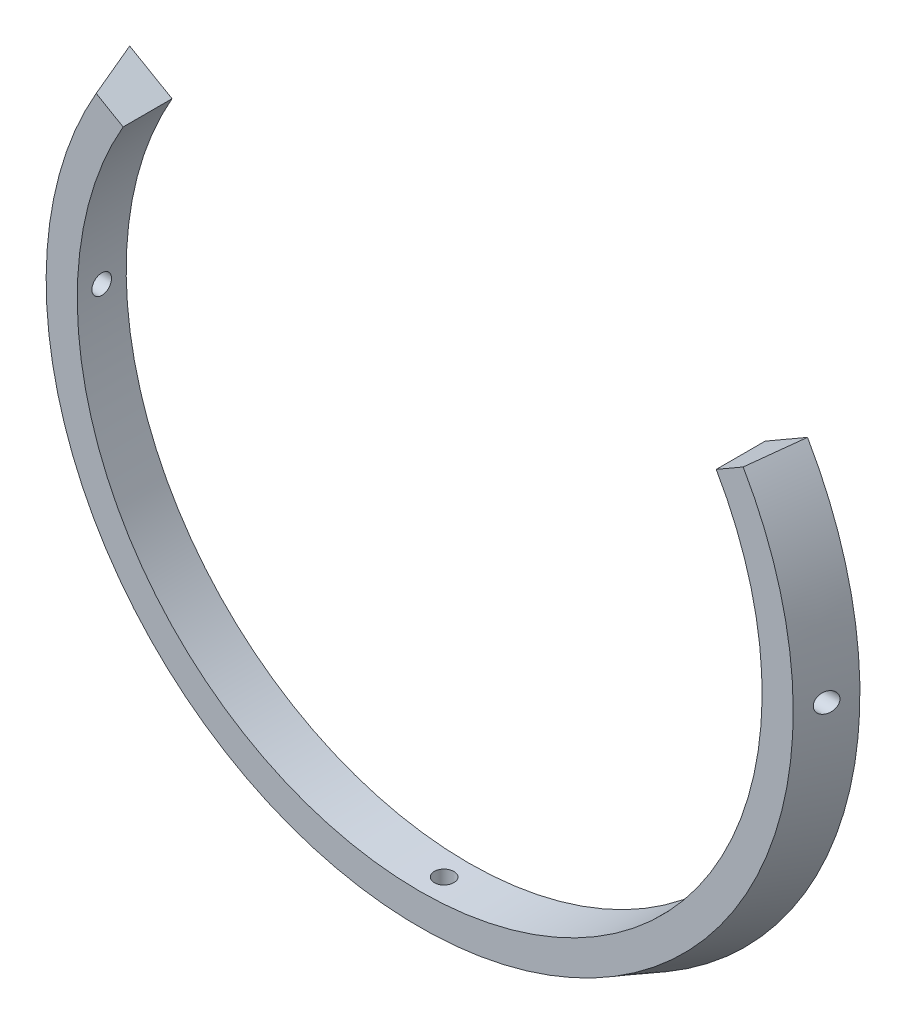
from build123d import *

# Parameters (mm, degrees)
SCHIZZO1_R                                = 80
SCHIZZO1_R_2                              = 70
ESTRUSIONE_ESTRUSIONE1_DEPTH              = 10
SMUSSO1_SIZE                              = 10
SMUSSO1_SIZE_2                            = 3.639702343
SCHIZZO2_R                                = 2
TAGLIO_ESTRUSIONE1_DEPTH                  = 114.578166916
RIPETIZIONECIRCOLARE1_COUNT               = 2
RIPETIZIONECIRCOLARE1_ANGLE               = 90
RIPETIZIONECIRCOLARE1_THE_OTHER_WAY_COUNT = 2
RIPETIZIONECIRCOLARE1_THE_OTHER_WAY_ANGLE = 90
TAGLIO_ESTRUSIONE3_DEPTH                  = 114.578167066


with BuildPart() as part:
    # Schizzo1 → Estrusione-Estrusione1 (new body)
    with BuildSketch(Plane.XY):
        Circle(SCHIZZO1_R)
        Circle(SCHIZZO1_R_2, mode=Mode.SUBTRACT)
    extrude(amount=ESTRUSIONE_ESTRUSIONE1_DEPTH)

    # Smusso1
    # the kernel refuses this chamfer: 10, 3.639702343 mm, written as the material it takes off along each edge
    with BuildSketch(Plane(origin=(0, 0, 10), x_dir=(1, 0, 0), z_dir=(0, -1, 0))) as smusso1_piece_1:
        Polygon((80, -SMUSSO1_SIZE), (80 - SMUSSO1_SIZE_2, 0), (80, 0), align=None)
    revolve(axis=Axis((0, 0, 10), (0, 0, 1)), mode=Mode.SUBTRACT)

    # Schizzo2 → Taglio-Estrusione1 (cut, through all)
    with BuildSketch(Plane(origin=(0, 0, 0), x_dir=(1, 0, 0), z_dir=(0, 1, 0))):
        with Locations(Location((0, -5, 0), (0, 0, 270))):
            Circle(SCHIZZO2_R)
    taglio_estrusione1 = extrude(amount=-TAGLIO_ESTRUSIONE1_DEPTH, mode=Mode.SUBTRACT)

    # RipetizioneCircolare1: Taglio-Estrusione1 ×2 about axis
    ripetizionecircolare1_axis = Axis((0, 0, 0), (0, 0, 1))
    for i in range(1, RIPETIZIONECIRCOLARE1_COUNT):
        add(taglio_estrusione1.rotate(ripetizionecircolare1_axis, i * RIPETIZIONECIRCOLARE1_ANGLE / (RIPETIZIONECIRCOLARE1_COUNT - 1)), mode=Mode.SUBTRACT)

    # RipetizioneCircolare1 the other way: Taglio-Estrusione1 ×2 about axis
    ripetizionecircolare1_the_other_way_axis = Axis((0, 0, 0), (0, 0, -1))
    for i in range(1, RIPETIZIONECIRCOLARE1_THE_OTHER_WAY_COUNT):
        add(taglio_estrusione1.rotate(ripetizionecircolare1_the_other_way_axis, i * RIPETIZIONECIRCOLARE1_THE_OTHER_WAY_ANGLE / (RIPETIZIONECIRCOLARE1_THE_OTHER_WAY_COUNT - 1)), mode=Mode.SUBTRACT)

    # Schizzo3 → Taglio-Estrusione3 (cut, through all)
    with BuildSketch(Plane(origin=(0, 0, 0), x_dir=(-1, 0, 0), z_dir=(0, 0, -1))):
        with BuildLine():
            Line((60.621778265, 35), (69.282032303, 40))
            ThreePointArc((69.282032303, 40), (0, 80), (-69.282032303, 40))
            Line((-69.282032303, 40), (-60.621778265, 35))
            ThreePointArc((-60.621778265, 35), (0, 70), (60.621778265, 35))
        make_face()
    extrude(amount=-TAGLIO_ESTRUSIONE3_DEPTH, mode=Mode.SUBTRACT)


solid = part.part
